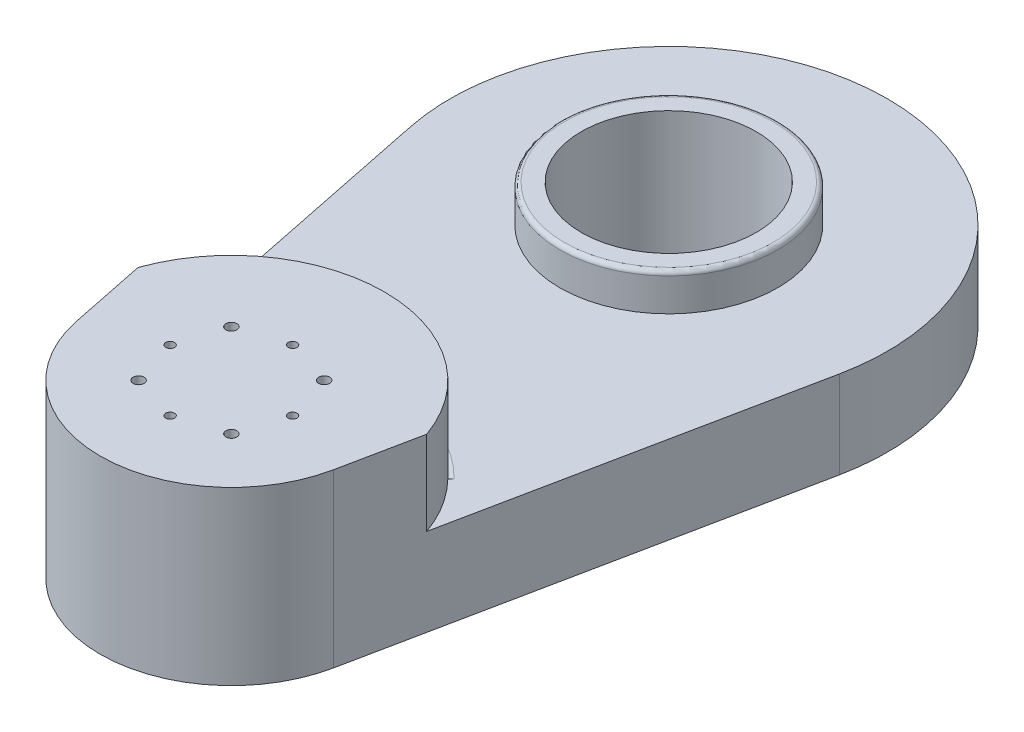
from build123d import *
from build123d.topology import SkipClean

# Parameters (mm, degrees)
EXTRUDE_1_DEPTH     = 20
SKETCH_2_R          = 24.9
EXTRUDE_2_DEPTH     = 8.5
FILLET_1_R          = 1
SKETCH_3_R          = 35
CUT_EXTRUDE_1_DEPTH = 5
EXTRUDE_START       = 24.25
EXTRUDE_4_DEPTH     = 24.25
FILLET_2_R          = 5
FILLET_3_R          = 1
CUT_EXTRUDE_2_DEPTH = 142.379144519
EXTRUDE_6_DEPTH     = 4
SKETCH_7_R          = 1
SKETCH_7_R_2        = 1.25
CUT_EXTRUDE_3_DEPTH = 145.708543286
SKETCH_8_R          = 20
CUT_EXTRUDE_4_DEPTH = 143.169792853


with BuildPart() as part:
    # 草图1 → 凸台-拉伸1 (new body)
    with BuildSketch(Plane(origin=(0, 0, 0), x_dir=(1, 0, 0), z_dir=(0, 1, 0))):
        with BuildLine():
            Line((29.393876872, -106.000000204), (48.989794952, -9.999999526))
            ThreePointArc((48.989794952, -9.999999526), (-6.1e-08, 50), (-48.989794928, -9.999999645))
            Line((-48.989794928, -9.999999645), (-29.393876792, -106.000000595))
            ThreePointArc((-29.393876792, -106.000000595), (2e-07, -130), (29.393876872, -106.000000204))
        make_face()
    extrude(amount=EXTRUDE_1_DEPTH)

    # 草图2 → 凸台-拉伸2 (add)
    with BuildSketch(Plane(origin=(0, 20, 0), x_dir=(1, 0, 0), z_dir=(0, 1, 0))):
        Circle(SKETCH_2_R)
    extrude(amount=EXTRUDE_2_DEPTH)

    # 圆角1
    fillet_1_edges = [part.edges().sort_by_distance(p)[0] for p in [
        (-24.9, 28.5, 0),
    ]]
    fillet(fillet_1_edges, radius=FILLET_1_R)

    # 草图3 → 切除-拉伸1 (cut)
    with BuildSketch(Plane(origin=(0, 20, 0), x_dir=(1, 0, 0), z_dir=(0, 1, 0))):
        with Locations((0, -100)):
            Circle(SKETCH_3_R)
    extrude(amount=-CUT_EXTRUDE_1_DEPTH, mode=Mode.SUBTRACT)

    # 草图4 → 凸台-拉伸4 (add)
    with BuildSketch(Plane(origin=(0, 15, 0), x_dir=(1, 0, 0), z_dir=(0, 1, 0)).offset(EXTRUDE_START)):
        with BuildLine():
            Line((-13.571428571, -86.702769968), (-25, -75.505102572))
            ThreePointArc((-25, -75.505102572), (-29.700916958, -81.483641506), (-32.999428189, -88.336478267))
            Line((-32.999428189, -88.336478267), (-29.393876913, -106))
            ThreePointArc((-29.393876913, -106), (0, -130), (29.393876913, -106))
            Line((29.393876913, -106), (32.999428189, -88.336478267))
            ThreePointArc((32.999428189, -88.336478267), (29.700916958, -81.483641506), (25, -75.505102572))
            Line((25, -75.505102572), (13.571428571, -86.702769968))
            ThreePointArc((13.571428571, -86.702769968), (17.590581896, -92.818675013), (19, -100))
            ThreePointArc((19, -100), (-7.181324987, -117.590581896), (-13.571428571, -86.702769968))
        make_face()
    extrude(amount=-EXTRUDE_4_DEPTH)

    # 圆角2
    fillet_2_edges = [part.edges().sort_by_distance(p)[0] for p in [
        (13.571428571, 27.125, 86.702769968),
        (-13.571428571, 27.125, 86.702769968),
    ]]
    fillet(fillet_2_edges, radius=FILLET_2_R)

    # 圆角3
    fillet_3_edges = [part.edges().sort_by_distance(p)[0] for p in [
        (0, 20, 65),
    ]]
    fillet(fillet_3_edges, radius=FILLET_3_R)

    # 草图5 → 切除-拉伸2 (cut, through all)
    with SkipClean():  # the faces are left unmerged after this step: merging them gives an invalid solid
        with BuildSketch(Plane(origin=(0, 15, 0), x_dir=(1, 0, 0), z_dir=(0, 1, 0))):
            with BuildLine():
                Line((-25, -75.505102572), (-16.766706563, -83.572049701))
                ThreePointArc((-16.766706563, -83.572049701), (-15.299084124, -86.569049032), (-16.043898953, -89.821920299))
                ThreePointArc((-16.043898953, -89.821920299), (0, -119), (16.043898953, -89.821920299))
                ThreePointArc((16.043898953, -89.821920299), (15.299084124, -86.569049032), (16.766706563, -83.572049701))
                Line((16.766706563, -83.572049701), (25, -75.505102572))
                ThreePointArc((25, -75.505102572), (0, -65), (-25, -75.505102572))
            make_face()
        extrude(amount=-CUT_EXTRUDE_2_DEPTH, mode=Mode.SUBTRACT)

    # 草图6 → 凸台-拉伸6 (add)
    with SkipClean():  # the faces are left unmerged after this step: merging them gives an invalid solid
        with BuildSketch(Plane(origin=(0, 39.25, 0), x_dir=(1, 0, 0), z_dir=(0, 1, 0))):
            with BuildLine():
                ThreePointArc((32.999428189, -88.336478267), (0, -65), (-32.999428189, -88.336478267))
                Line((-32.999428189, -88.336478267), (-29.393876913, -106))
                ThreePointArc((-29.393876913, -106), (0, -130), (29.393876913, -106))
                Line((29.393876913, -106), (32.999428189, -88.336478267))
            make_face()
        extrude(amount=-EXTRUDE_6_DEPTH)

    # 草图7 → 切除-拉伸3 (cut, through all)
    with SkipClean():  # the faces are left unmerged after this step: merging them gives an invalid solid
        with BuildSketch(Plane(origin=(0, 39.25, 0), x_dir=(1, 0, 0), z_dir=(0, 1, 0))):
            with Locations((0, -86)):
                Circle(SKETCH_7_R)
            with Locations((14, -100)):
                Circle(SKETCH_7_R)
            with Locations((0, -114)):
                Circle(SKETCH_7_R)
            with Locations((-14, -100)):
                Circle(SKETCH_7_R)
            with Locations((-10.606601718, -89.393398282)):
                Circle(SKETCH_7_R_2)
            with Locations((10.606601718, -89.393398282)):
                Circle(SKETCH_7_R_2)
            with Locations((10.606601718, -110.606601718)):
                Circle(SKETCH_7_R_2)
            with Locations((-10.606601718, -110.606601718)):
                Circle(SKETCH_7_R_2)
        extrude(amount=-CUT_EXTRUDE_3_DEPTH, mode=Mode.SUBTRACT)

    # 草图8 → 切除-拉伸4 (cut, through all)
    with SkipClean():  # the faces are left unmerged after this step: merging them gives an invalid solid
        with BuildSketch(Plane(origin=(0, 28.5, 0), x_dir=(1, 0, 0), z_dir=(0, 1, 0))):
            Circle(SKETCH_8_R)
        extrude(amount=-CUT_EXTRUDE_4_DEPTH, mode=Mode.SUBTRACT)


solid = part.part
